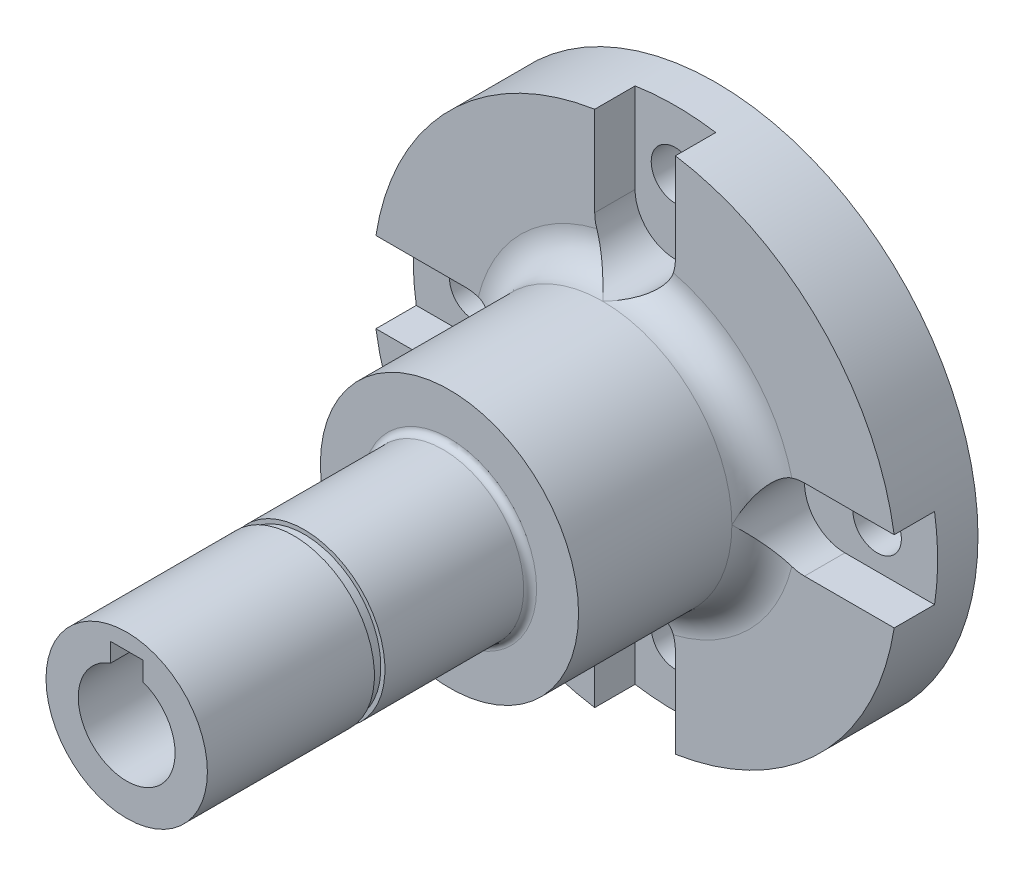
from build123d import *
from build123d.topology import SkipClean

# Parameters (mm, degrees)
SZKIC1_R                         = 10
DODANIE_WYCI_GNI_CIE1_DEPTH      = 60
SZKIC3_R                         = 6
WYTNIJ_WYCI_GNI_CIE1_DEPTH       = 50
WYTNIJ_WYCI_GNI_CIE2_DEPTH       = 20
SZKIC9_R                         = 32.5
SZKIC9_R_2                       = 3
SZKIC9_R_3                       = 10
DODANIE_WYCI_GNI_CIE3_DEPTH      = 10
SZKIC12_R                        = 10
DODANIE_WYCI_GNI_CIE4_DEPTH      = 10
DODANIE_WYCI_GNI_CIE6_DEPTH      = 4
DODANIE_WYCI_GNI_CIE6_DEPTH_BACK = 10
SZKIC13_R                        = 16
SZKIC13_R_2                      = 10
SZKIC14_W                        = 1.3
SZKIC14_H                        = 0.5
FILLET3_R                        = 4
WYTNIJ_WYCI_GNI_CIE4_START       = -5
WYTNIJ_WYCI_GNI_CIE4_DEPTH       = 15
CUT_EXTRUDE1_DEPTH               = 84.740671122
CUT_EXTRUDE1_DEPTH_BACK          = 84.740671122
FILLET1_R                        = 0.8
CIRPATTERN1_COUNT                = 4
PRZENIE_CIAN_1_OUTLINE_W         = 0.5
PRZENIE_CIAN_1_OUTLINE_H         = 1.3
PRZENIE_CIAN_1_2_OUTLINE_W       = 0.5
PRZENIE_CIAN_1_2_OUTLINE_H       = 1.3
PRZENIE_CIAN_2_BY                = 3


with BuildPart() as part:
    # Szkic1 → Dodanie-wyciągnięcie1 (new body)
    with BuildSketch(Plane.XY):
        Circle(SZKIC1_R)
    extrude(amount=DODANIE_WYCI_GNI_CIE1_DEPTH)

    # Szkic3 → Wytnij-wyciągnięcie1 (cut)
    with BuildSketch(Plane.XY.offset(60)):
        Circle(SZKIC3_R)
    extrude(amount=-WYTNIJ_WYCI_GNI_CIE1_DEPTH, mode=Mode.SUBTRACT)

    # Szkic8 → Wytnij-wyciągnięcie2 (cut)
    with BuildSketch(Plane.XY.offset(60)):
        with BuildLine():
            Line((0, 8), (0, 6))
            ThreePointArc((0, 6), (1.014611872, 5.913591358), (2, 5.656854249))
            Line((2, 5.656854249), (2, 8))
            Line((2, 8), (0, 8))
        make_face()
        with BuildLine():
            ThreePointArc((-2, 5.656854249), (-1.014611872, 5.913591358), (0, 6))
            Line((0, 6), (0, 8))
            Line((0, 8), (-2, 8))
            Line((-2, 8), (-2, 5.656854249))
        make_face()
    extrude(amount=-WYTNIJ_WYCI_GNI_CIE2_DEPTH, mode=Mode.SUBTRACT)


with BuildPart() as body_2:
    # Szkic9 → Dodanie-wyciągnięcie3 (new body)
    with BuildSketch(Plane(origin=(0, 0, 0), x_dir=(-1, 0, 0), z_dir=(0, 0, -1))):
        Circle(SZKIC9_R)
        with Locations((0, 25)):
            Circle(SZKIC9_R_2, mode=Mode.SUBTRACT)
        with Locations((-25, 0)):
            Circle(SZKIC9_R_2, mode=Mode.SUBTRACT)
        with Locations((0, -25)):
            Circle(SZKIC9_R_2, mode=Mode.SUBTRACT)
        with Locations((25, 0)):
            Circle(SZKIC9_R_2, mode=Mode.SUBTRACT)
        with Locations(Location((0, 0, 0), (0, 0, 180))):
            Circle(SZKIC9_R_3, mode=Mode.SUBTRACT)
    extrude(amount=DODANIE_WYCI_GNI_CIE3_DEPTH)


with BuildPart() as dodanie_wyci_gni_cie4_tool:
    # Szkic12 → Dodanie-wyciągnięcie4 (new body)
    with BuildSketch(Plane(origin=(0, 0, -10), x_dir=(-1, 0, 0), z_dir=(0, 0, -1))):
        Circle(SZKIC12_R)
    extrude(amount=-DODANIE_WYCI_GNI_CIE4_DEPTH)


with BuildPart() as part_1:
    add(part.part)


with BuildPart() as part_2:
    # Dodanie-wyciągnięcie4: joined with dodanie_wyci_gni_cie4_tool
    add(part_1.part.fuse(dodanie_wyci_gni_cie4_tool.part, body_2.part, tol=0.00001))

    # Szkic13 → Dodanie-wyciągnięcie6 (add, two sides: drawn at the far end of the back side and taken through both)
    with BuildSketch(Plane.XY.offset(10).offset(-DODANIE_WYCI_GNI_CIE6_DEPTH_BACK)):
        Circle(SZKIC13_R)
        Circle(SZKIC13_R_2, mode=Mode.SUBTRACT)
    extrude(amount=DODANIE_WYCI_GNI_CIE6_DEPTH + DODANIE_WYCI_GNI_CIE6_DEPTH_BACK)

    # Szkic14 → Wycięcie-obrót1 (revolve, cut)
    with BuildSketch(Plane(origin=(0, 0, 0), x_dir=(0, 0, -1), z_dir=(1, 0, 0)), mode=Mode.PRIVATE) as wyci_cie_obr_t1_sk:
        with Locations((-32.65, 9.75)):
            Rectangle(SZKIC14_W, SZKIC14_H)
    revolve(wyci_cie_obr_t1_sk.sketch.rotate(Axis((0, 0, 10), (0, 0, 1)), 90), axis=Axis((0, 0, 10), (0, 0, 1)), mode=Mode.SUBTRACT)

    # Fillet3
    fillet3_edges = [part_2.edges().sort_by_distance(p)[0] for p in [
        (-16, 0, 0),
    ]]
    fillet(fillet3_edges, radius=FILLET3_R)

    # Szkic15 → Wytnij-wyciągnięcie4 (cut)
    with SkipClean():  # the faces are left unmerged after this step: merging them gives an invalid solid
        with BuildSketch(Plane.XY.offset(WYTNIJ_WYCI_GNI_CIE4_START)):
            with BuildLine():
                Line((-21, 5), (-38.344899327, 5))
                Line((-38.344899327, 5), (-38.344899327, -5))
                Line((-38.344899327, -5), (-21, -5))
                ThreePointArc((-21, -5), (-16, 0), (-21, 5))
            make_face()
        wytnij_wyci_gni_cie4 = extrude(amount=WYTNIJ_WYCI_GNI_CIE4_DEPTH, mode=Mode.SUBTRACT)

    # Sketch1 → Cut-Extrude1 (cut, two sides: drawn at the far end of the back side and taken through both)
    with SkipClean():  # the faces are left unmerged after this step: merging them gives an invalid solid
        with BuildSketch(Plane.XY.offset(60).offset(-CUT_EXTRUDE1_DEPTH_BACK)):
            with BuildLine():
                ThreePointArc((2, 5.656854249), (0, 6), (-2, 5.656854249))
                ThreePointArc((-2, 5.656854249), (-3.464101615, -4.898979486), (6, 0))
                ThreePointArc((6, 0), (4.898979486, 3.464101615), (2, 5.656854249))
            make_face()
            with BuildLine():
                Line((2, 8), (-2, 8))
                Line((-2, 8), (-2, 5.656854249))
                ThreePointArc((-2, 5.656854249), (0, 6), (2, 5.656854249))
                Line((2, 5.656854249), (2, 8))
            make_face()
        extrude(amount=CUT_EXTRUDE1_DEPTH + CUT_EXTRUDE1_DEPTH_BACK, mode=Mode.SUBTRACT)

    # Fillet1
    fillet1_edges = [part_2.edges().sort_by_distance(p)[0] for p in [
        (-10, 0, 14),
    ]]
    fillet(fillet1_edges, radius=FILLET1_R)

    # CirPattern1: Wytnij-wyciągnięcie4 ×4 about axis
    cirpattern1_axis = Axis((0, 0, 0), (0, 0, 1))
    for i in range(1, CIRPATTERN1_COUNT):
        add(wytnij_wyci_gni_cie4.rotate(cirpattern1_axis, i * 360 / CIRPATTERN1_COUNT), mode=Mode.SUBTRACT)

    # Przenieś ścianę1: read off the stored shape, not the designer's step
    # Przenieś ścianę1 outline → Przenieś ścianę1 (revolve, cut)
    with BuildSketch(Plane.XZ):
        with Locations((9.75, 41.65)):
            Rectangle(PRZENIE_CIAN_1_OUTLINE_W, PRZENIE_CIAN_1_OUTLINE_H)
    revolve(axis=Axis((0, 0, 0), (0, 0, 1)), mode=Mode.SUBTRACT)

    # Przenie_ _cian_1 2 outline → Przenie_ _cian_1 2 (revolve)
    with BuildSketch(Plane.XZ):
        with Locations((9.75, 32.65)):
            Rectangle(PRZENIE_CIAN_1_2_OUTLINE_W, PRZENIE_CIAN_1_2_OUTLINE_H)
        with BuildLine():
            ThreePointArc((10.8, 23), (10.234314575, 23.234314575), (10, 23.8))
            Line((10, 23.8), (10, 14.8))
            ThreePointArc((10, 14.8), (10.234314575, 14.234314575), (10.8, 14))
            Line((10.8, 14), (16, 14))
            Line((16, 14), (16, 23))
            Line((16, 23), (10.8, 23))
        make_face()
    revolve(axis=Axis((0, 0, 0), (0, 0, 1)))

    # Przenieś ścianę2: a face moved outward by 3.0
    extrude(part_2.faces().sort_by_distance((0, -8, 60))[0], amount=PRZENIE_CIAN_2_BY, dir=(0, 0, 1))


solid = part_2.part
